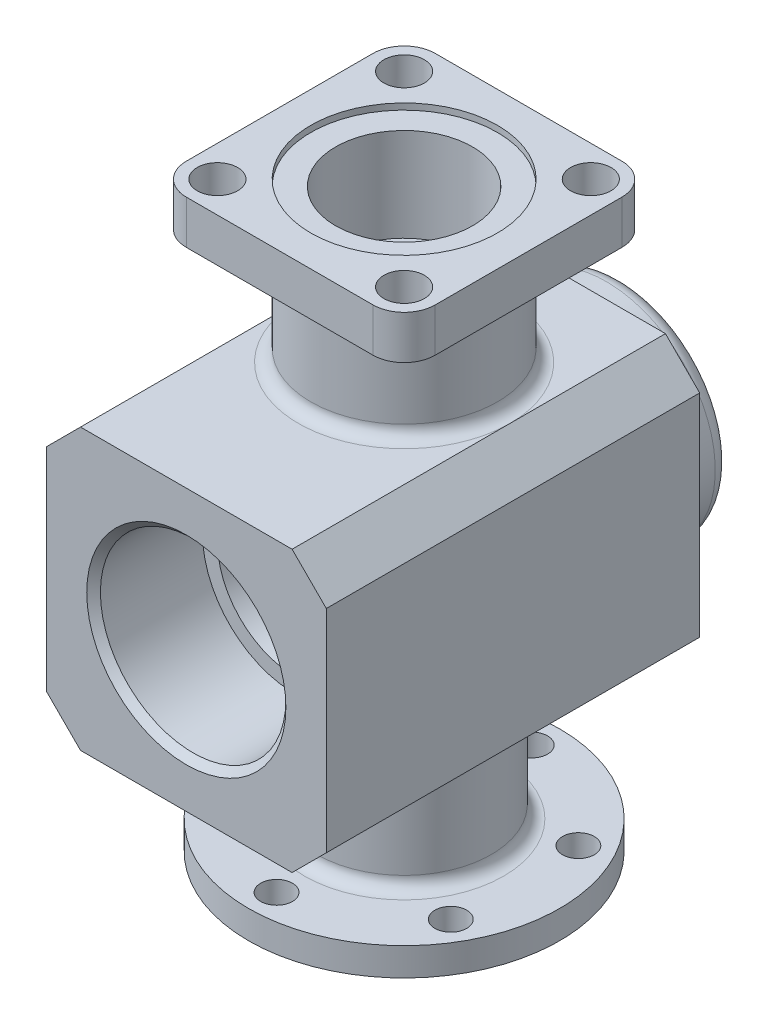
from build123d import *

# Parameters (mm, degrees)
SKETCH_1_W               = 90
SKETCH_1_H               = 90
EXTRUDE_1_DEPTH          = 120
SKETCH_9_R               = 35
EXTRUDE_6_DEPTH          = 20
SKETCH_2_R               = 30
EXTRUDE_2_DEPTH          = 51
SKETCH_3_W               = 80
SKETCH_3_H               = 80
EXTRUDE_3_DEPTH          = 14
SKETCH_4_R               = 28
EXTRUDE_4_DEPTH          = 46
SKETCH_5_R               = 50
EXTRUDE_5_DEPTH          = 9
SKETCH_6_R               = 15
CUT_EXTRUDE_1_DEPTH      = 228.747667387
SKETCH_7_R               = 22
CUT_EXTRUDE_2_DEPTH      = 32
FILLET_1_R               = 10
SKETCH_10_R              = 6.5
CUT_EXTRUDE_4_DEPTH      = 14
CHAMFER_1_SIZE           = 11
FILLET_2_R               = 5
SKETCH_11_R              = 29.805
CUT_EXTRUDE_5_DEPTH      = 35
CHAMFER_2_SIZE           = 2.195
CUT_EXTRUDE_START        = -2
SKETCH_14_R              = 30
CUT_EXTRUDE_6_DEPTH      = 2
FILLET_3_R               = 4
SKETCH_15_R              = 5.1
CUT_EXTRUDE_7_DEPTH      = 9
SKETCH_16_R              = 30.5
SKETCH_16_R_2            = 24.5
CUT_EXTRUDE_8_DEPTH      = 5.8
PATTERN_CIRCULAR_2_COUNT = 6


with BuildPart() as part:
    # Эскиз1 → Бобышка-Вытянуть1 (new body)
    with BuildSketch(Plane.XY):
        Rectangle(SKETCH_1_W, SKETCH_1_H)
    extrude(amount=EXTRUDE_1_DEPTH)

    # Эскиз9 → Бобышка-Вытянуть6 (add)
    with BuildSketch(Plane(origin=(0, 0, 0), x_dir=(-1, 0, 0), z_dir=(0, 0, -1))):
        Circle(SKETCH_9_R)
    extrude(amount=EXTRUDE_6_DEPTH)

    # Эскиз2 → Бобышка-Вытянуть2 (add)
    with BuildSketch(Plane(origin=(0, 45, 0), x_dir=(1, 0, 0), z_dir=(0, 1, 0))):
        with Locations(Location((0, -50, 0), (0, 0, 90))):
            Circle(SKETCH_2_R)
    extrude(amount=EXTRUDE_2_DEPTH)

    # Эскиз3 → Бобышка-Вытянуть3 (add)
    with BuildSketch(Plane(origin=(0, 96, 0), x_dir=(1, 0, 0), z_dir=(0, 1, 0))):
        with Locations((0, -50)):
            Rectangle(SKETCH_3_W, SKETCH_3_H)
    extrude(amount=-EXTRUDE_3_DEPTH)

    # Эскиз4 → Бобышка-Вытянуть4 (add)
    with BuildSketch(Plane.XZ.offset(45)):
        with Locations(Location((0, 50, 0), (0, 0, 90))):
            Circle(SKETCH_4_R)
    extrude(amount=EXTRUDE_4_DEPTH)

    # Эскиз5 → Бобышка-Вытянуть5 (add)
    with BuildSketch(Plane.XZ.offset(91)):
        with Locations(Location((0, 50, 0), (0, 0, 270))):
            Circle(SKETCH_5_R)
    extrude(amount=-EXTRUDE_5_DEPTH)

    # Эскиз6 → Вырез-Вытянуть1 (cut, through all)
    with BuildSketch(Plane(origin=(0, -91, 0), x_dir=(-1, 0, 0), z_dir=(0, -1, 0))):
        with Locations(Location((0, -50, 0), (0, 0, 90))):
            Circle(SKETCH_6_R)
    extrude(amount=-CUT_EXTRUDE_1_DEPTH, mode=Mode.SUBTRACT)

    # Эскиз7 → Вырез-Вытянуть2 (cut)
    with BuildSketch(Plane(origin=(0, 96, 0), x_dir=(1, 0, 0), z_dir=(0, 1, 0))):
        with Locations(Location((0, -50, 0), (0, 0, 270))):
            Circle(SKETCH_7_R)
    extrude(amount=-CUT_EXTRUDE_2_DEPTH, mode=Mode.SUBTRACT)

    # Скругление1
    fillet_1_edges = [part.edges().sort_by_distance(p)[0] for p in [
        (40, 89, 10),
        (40, 89, 90),
        (-40, 89, 90),
        (-40, 89, 10),
    ]]
    fillet(fillet_1_edges, radius=FILLET_1_R)

    # Эскиз10 → Вырез-Вытянуть4 (cut)
    with BuildSketch(Plane(origin=(0, 96, 0), x_dir=(1, 0, 0), z_dir=(0, 1, 0))):
        with Locations(Location((-30, -20, 0), (0, 0, 270))):
            Circle(SKETCH_10_R)
        with Locations(Location((30, -80, 0), (0, 0, 90))):
            Circle(SKETCH_10_R)
        with Locations(Location((30, -20, 0), (0, 0, 270))):
            Circle(SKETCH_10_R)
        with Locations(Location((-30, -80, 0), (0, 0, 270))):
            Circle(SKETCH_10_R)
    extrude(amount=-CUT_EXTRUDE_4_DEPTH, mode=Mode.SUBTRACT)

    # Фаска1
    chamfer_1_edges = [part.edges().sort_by_distance(p)[0] for p in [
        (45, -45, 60),
        (-45, -45, 60),
        (-45, 45, 60),
        (45, 45, 60),
    ]]
    chamfer(chamfer_1_edges, length=CHAMFER_1_SIZE)

    # Скругление2
    fillet_2_edges = [part.edges().sort_by_distance(p)[0] for p in [
        (35, 0, 0),
        (35, 0, -20),
    ]]
    fillet(fillet_2_edges, radius=FILLET_2_R)

    # Эскиз11 → Вырез-Вытянуть5 (cut)
    with BuildSketch(Plane.XY.offset(120)):
        Circle(SKETCH_11_R)
    extrude(amount=-CUT_EXTRUDE_5_DEPTH, mode=Mode.SUBTRACT)

    # Эскиз13 → Вырез-Повернуть1 (revolve, cut)
    with BuildSketch(Plane(origin=(0, 0, 0), x_dir=(0, 0, -1), z_dir=(1, 0, 0))):
        Polygon((-85, 25), (5, 12.351324877), (5, 0), (-85, 0), align=None)
    revolve(axis=Axis((0, 0, 0), (0, 0, 1)), mode=Mode.SUBTRACT)

    # Фаска2
    chamfer_2_edges = [part.edges().sort_by_distance(p)[0] for p in [
        (-29.805, 0, 120),
    ]]
    chamfer(chamfer_2_edges, length=CHAMFER_2_SIZE)

    # Эскиз14 → Вырез-Вытянуть6 (cut)
    with BuildSketch(Plane(origin=(0, 96, 0), x_dir=(1, 0, 0), z_dir=(0, 1, 0)).offset(CUT_EXTRUDE_START)):
        with Locations(Location((0, -50, 0), (0, 0, 90))):
            Circle(SKETCH_14_R)
    extrude(amount=CUT_EXTRUDE_6_DEPTH, mode=Mode.SUBTRACT)

    # Скругление3
    fillet_3_edges = [part.edges().sort_by_distance(p)[0] for p in [
        (0, 45, 80),
        (0, 82, 80),
        (0, -45, 22),
        (0, -82, 22),
    ]]
    fillet(fillet_3_edges, radius=FILLET_3_R - 0.0001)  # a hair under: the kernel refuses the full size

    # Эскиз15 → Вырез-Вытянуть7 (cut)
    with BuildSketch(Plane.XZ.offset(91)):
        with Locations(Location((0, 91, 0), (0, 0, 270))):
            Circle(SKETCH_15_R)
    cut_extrude_7 = extrude(amount=-CUT_EXTRUDE_7_DEPTH, mode=Mode.SUBTRACT)

    # Эскиз16 → Вырез-Вытянуть8 (cut)
    with BuildSketch(Plane.XZ.offset(91)):
        with Locations(Location((0, 50, 0), (0, 0, 270))):
            Circle(SKETCH_16_R)
        with Locations(Location((0, 50, 0), (0, 0, 270))):
            Circle(SKETCH_16_R_2, mode=Mode.SUBTRACT)
    extrude(amount=-CUT_EXTRUDE_8_DEPTH, mode=Mode.SUBTRACT)

    # Круговой массив2: Вырез-Вытянуть7 ×6 about axis
    pattern_circular_2_axis = Axis((0, 0, 50), (0, 1, 0))
    for i in range(1, PATTERN_CIRCULAR_2_COUNT):
        add(cut_extrude_7.rotate(pattern_circular_2_axis, i * 360 / PATTERN_CIRCULAR_2_COUNT), mode=Mode.SUBTRACT)


solid = part.part
